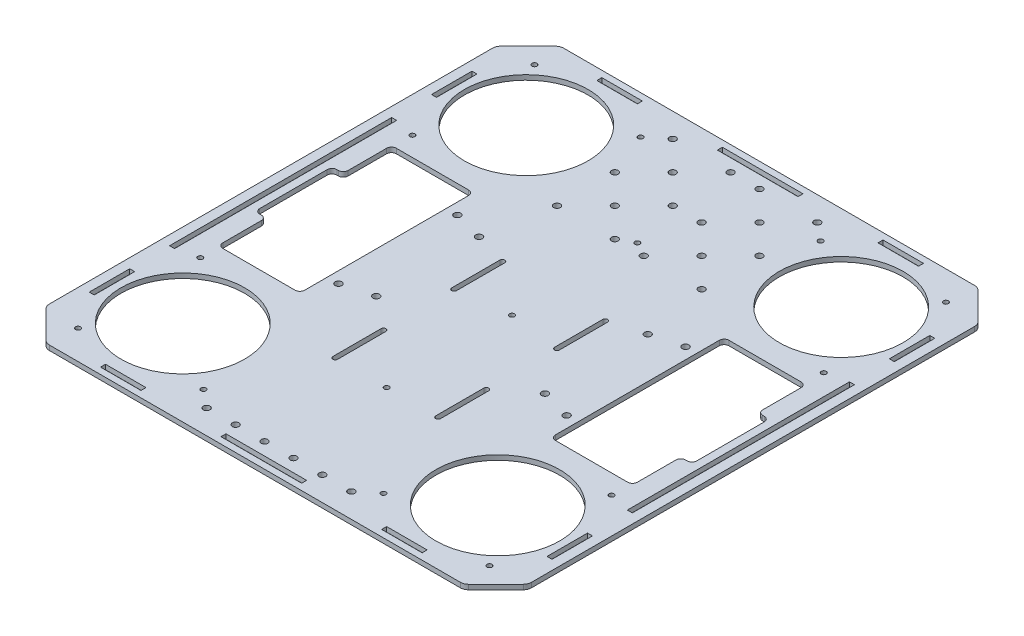
from build123d import *

# Parameters (mm, degrees)
SKETCH1_R          = 2.075
SKETCH1_R_2        = 38.5
BASE_FLANGE1_DEPTH = 3
SKETCH6_R          = 1.55
SKETCH6_W          = 25.2
SKETCH6_H          = 3.1
SKETCH6_W_2        = 3.1
SKETCH6_H_2        = 25.2
SKETCH6_W_3        = 50.2
CUT_EXTRUDE1_DEPTH = 10
FILLET1_R          = 3
SKETCH7_R          = 2.05
CUT_EXTRUDE2_DEPTH = 10


# Sheet-metal steps are written as plain solids
with BuildPart() as part:
    # Sketch1 → Base-Flange1 (new body)
    with BuildSketch(Plane(origin=(0, 0, 0), x_dir=(1, 0, 0), z_dir=(0, 1, 0))):
        with BuildLine():
            Line((150, 137.928932188), (150, 56.076665041))
            Line((150, 56.076665041), (150, -55.923334959))
            Line((150, -55.923334959), (150, -137.928932188))
            ThreePointArc((150, -137.928932188), (149.619397663, -139.84234935), (148.535533906, -141.464466094))
            Line((148.535533906, -141.464466094), (131.464466094, -158.535533906))
            ThreePointArc((131.464466094, -158.535533906), (129.84234935, -159.619397663), (127.928932188, -160))
            Line((127.928932188, -160), (-127.928932188, -160))
            ThreePointArc((-127.928932188, -160), (-129.84234935, -159.619397663), (-131.464466094, -158.535533906))
            Line((-131.464466094, -158.535533906), (-148.535533906, -141.464466094))
            ThreePointArc((-148.535533906, -141.464466094), (-149.619397663, -139.84234935), (-150, -137.928932188))
            Line((-150, -137.928932188), (-150, -55.923334959))
            Line((-150, -55.923334959), (-150, 56.076665041))
            Line((-150, 56.076665041), (-150, 137.928932188))
            ThreePointArc((-150, 137.928932188), (-149.619397663, 139.84234935), (-148.535533906, 141.464466094))
            Line((-148.535533906, 141.464466094), (-131.464466094, 158.535533906))
            ThreePointArc((-131.464466094, 158.535533906), (-129.84234935, 159.619397663), (-127.928932188, 160))
            Line((-127.928932188, 160), (127.928932188, 160))
            ThreePointArc((127.928932188, 160), (129.84234935, 159.619397663), (131.464466094, 158.535533906))
            Line((131.464466094, 158.535533906), (148.535533906, 141.464466094))
            ThreePointArc((148.535533906, 141.464466094), (149.619397663, 139.84234935), (150, 137.928932188))
        make_face()
        with Locations(Location((52.5, 32, 0), (0, 0, 270))):
            Circle(SKETCH1_R, mode=Mode.SUBTRACT)
        with Locations(Location((52.5, -32, 0), (0, 0, 90))):
            Circle(SKETCH1_R, mode=Mode.SUBTRACT)
        with Locations(Location((-52.5, -32, 0), (0, 0, 270))):
            Circle(SKETCH1_R, mode=Mode.SUBTRACT)
        with Locations(Location((-52.5, 32, 0), (0, 0, 90))):
            Circle(SKETCH1_R, mode=Mode.SUBTRACT)
        with Locations(Location((-98, 106.869078783, 0), (0, 0, 270))):
            Circle(SKETCH1_R_2, mode=Mode.SUBTRACT)
        with Locations(Location((98, 106.869078783, 0), (0, 0, 90))):
            Circle(SKETCH1_R_2, mode=Mode.SUBTRACT)
        with Locations(Location((-98, -106.869078783, 0), (0, 0, 90))):
            Circle(SKETCH1_R_2, mode=Mode.SUBTRACT)
        with Locations(Location((98, -106.869078783, 0), (0, 0, 270))):
            Circle(SKETCH1_R_2, mode=Mode.SUBTRACT)
        with Locations(Location((-71, 37, 0), (0, 0, 270))):
            Circle(SKETCH1_R, mode=Mode.SUBTRACT)
        with Locations(Location((-71, -37, 0), (0, 0, 90))):
            Circle(SKETCH1_R, mode=Mode.SUBTRACT)
        with Locations(Location((71, 37, 0), (0, 0, 90))):
            Circle(SKETCH1_R, mode=Mode.SUBTRACT)
        with Locations(Location((71, -37, 0), (0, 0, 270))):
            Circle(SKETCH1_R, mode=Mode.SUBTRACT)
        Polygon((129, 54), (78, 54), (78, -54), (129, -54), (129, -24), (136, -24), (136, 24), (129, 24), align=None, mode=Mode.SUBTRACT)
        Polygon((-129, 54), (-78, 54), (-78, -54), (-129, -54), (-129, -24), (-136, -24), (-136, 24), (-129, 24), align=None, mode=Mode.SUBTRACT)
    extrude(amount=-BASE_FLANGE1_DEPTH)

    # Sketch6 → Cut-Extrude1 (cut)
    with BuildSketch(Plane(origin=(0, 0, 0), x_dir=(1, 0, 0), z_dir=(0, 1, 0))):
        with Locations(Location((128, 142, 0), (0, 0, 270))):
            Circle(SKETCH6_R)
        with Locations(Location((-56, 136, 0), (0, 0, 90))):
            Circle(SKETCH6_R)
        with Locations(Location((-128, 142, 0), (0, 0, 90))):
            Circle(SKETCH6_R)
        with Locations(Location((128, 66, 0), (0, 0, 270))):
            Circle(SKETCH6_R)
        with Locations(Location((56, 136, 0), (0, 0, 270))):
            Circle(SKETCH6_R)
        with Locations(Location((-128, -142, 0), (0, 0, 270))):
            Circle(SKETCH6_R)
        with Locations(Location((128, -66, 0), (0, 0, 90))):
            Circle(SKETCH6_R)
        with Locations(Location((128, -142, 0), (0, 0, 90))):
            Circle(SKETCH6_R)
        with Locations(Location((0, 78, 0), (0, 0, 270))):
            Circle(SKETCH6_R)
        with Locations(Location((0, -78, 0), (0, 0, 90))):
            Circle(SKETCH6_R)
        with Locations(Location((56, -136, 0), (0, 0, 90))):
            Circle(SKETCH6_R)
        with Locations(Location((-56, -136, 0), (0, 0, 270))):
            Circle(SKETCH6_R)
        with Locations(Location((-128, 66, 0), (0, 0, 90))):
            Circle(SKETCH6_R)
        with Locations(Location((-128, -66, 0), (0, 0, 270))):
            Circle(SKETCH6_R)
        with Locations(Location((0, 0, 0), (0, 0, 270))):
            Circle(SKETCH6_R)
        with Locations((87.5, 154.45)):
            Rectangle(SKETCH6_W, SKETCH6_H)
        Polygon((140.9, 54), (140.9, 69.1), (144, 69.1), (144, 54), (144, -54), (144, -69.1), (140.9, -69.1), (140.9, -54), align=None)
        with Locations((142.45, 106.5)):
            Rectangle(SKETCH6_W_2, SKETCH6_H_2)
        with Locations((0, 154.45)):
            Rectangle(SKETCH6_W_3, SKETCH6_H)
        with Locations((-87.5, 154.45)):
            Rectangle(SKETCH6_W, SKETCH6_H)
        Polygon((-144, 69.1), (-144, 54), (-144, -54), (-144, -69.1), (-140.9, -69.1), (-140.9, -54), (-140.9, 54), (-140.9, 69.1), align=None)
        with Locations((-142.45, 106.5)):
            Rectangle(SKETCH6_W_2, SKETCH6_H_2)
        with Locations((-142.45, -106.5)):
            Rectangle(SKETCH6_W_2, SKETCH6_H_2)
        with Locations((142.45, -106.5)):
            Rectangle(SKETCH6_W_2, SKETCH6_H_2)
        with Locations((87.5, -154.45)):
            Rectangle(SKETCH6_W, SKETCH6_H)
        with Locations((-87.5, -154.45)):
            Rectangle(SKETCH6_W, SKETCH6_H)
        with Locations((0, -154.45)):
            Rectangle(SKETCH6_W_3, SKETCH6_H)
        with BuildLine():
            Line((-33.5, -78), (-33.5, -48))
            ThreePointArc((-33.5, -48), (-32, -46.5), (-30.5, -48))
            Line((-30.5, -48), (-30.5, -78))
            ThreePointArc((-30.5, -78), (-32, -79.5), (-33.5, -78))
        make_face()
        with BuildLine():
            Line((33.5, -78), (33.5, -48))
            ThreePointArc((33.5, -48), (32, -46.5), (30.5, -48))
            Line((30.5, -48), (30.5, -78))
            ThreePointArc((30.5, -78), (32, -79.5), (33.5, -78))
        make_face()
        with BuildLine():
            Line((-33.5, -4), (-33.5, 26))
            ThreePointArc((-33.5, 26), (-32, 27.5), (-30.5, 26))
            Line((-30.5, 26), (-30.5, -4))
            ThreePointArc((-30.5, -4), (-32, -5.5), (-33.5, -4))
        make_face()
        with BuildLine():
            Line((33.5, -4), (33.5, 26))
            ThreePointArc((33.5, 26), (32, 27.5), (30.5, 26))
            Line((30.5, 26), (30.5, -4))
            ThreePointArc((30.5, -4), (32, -5.5), (33.5, -4))
        make_face()
    extrude(amount=-CUT_EXTRUDE1_DEPTH, mode=Mode.SUBTRACT)

    # Fillet1
    fillet1_edges = [part.edges().sort_by_distance(p)[0] for p in [
        (-78, -1.5, -54),
        (-78, -1.5, 54),
        (-129, -1.5, 54),
        (-129, -1.5, 24),
        (-136, -1.5, 24),
        (-136, -1.5, -24),
        (-129, -1.5, -24),
        (-129, -1.5, -54),
        (129, -1.5, 54),
        (78, -1.5, 54),
        (78, -1.5, -54),
        (129, -1.5, -54),
        (129, -1.5, -24),
        (136, -1.5, -24),
        (136, -1.5, 24),
        (129, -1.5, 24),
    ]]
    fillet(fillet1_edges, radius=FILLET1_R)

    # Sketch7 → Cut-Extrude2 (cut)
    with BuildSketch(Plane(origin=(0, 0, 0), x_dir=(1, 0, 0), z_dir=(0, 1, 0))):
        with Locations(Location((-27, -145, 0), (0, 0, 270))):
            Circle(SKETCH7_R)
        with Locations(Location((-9, -145, 0), (0, 0, 270))):
            Circle(SKETCH7_R)
        with Locations(Location((-45, -145, 0), (0, 0, 270))):
            Circle(SKETCH7_R)
        with Locations(Location((45, -145, 0), (0, 0, 90))):
            Circle(SKETCH7_R)
        with Locations(Location((27, -145, 0), (0, 0, 90))):
            Circle(SKETCH7_R)
        with Locations(Location((9, -145, 0), (0, 0, 90))):
            Circle(SKETCH7_R)
        with Locations(Location((9, 145, 0), (0, 0, 270))):
            Circle(SKETCH7_R)
        with Locations(Location((45, 145, 0), (0, 0, 270))):
            Circle(SKETCH7_R)
        with Locations(Location((-45, 145, 0), (0, 0, 90))):
            Circle(SKETCH7_R)
        with Locations(Location((-9, 145, 0), (0, 0, 90))):
            Circle(SKETCH7_R)
        with Locations(Location((27, 127, 0), (0, 0, 270))):
            Circle(SKETCH7_R)
        with Locations(Location((9, 109, 0), (0, 0, 270))):
            Circle(SKETCH7_R)
        with Locations(Location((45, 109, 0), (0, 0, 270))):
            Circle(SKETCH7_R)
        with Locations(Location((27, 91, 0), (0, 0, 270))):
            Circle(SKETCH7_R)
        with Locations(Location((-27, 91, 0), (0, 0, 90))):
            Circle(SKETCH7_R)
        with Locations(Location((-45, 109, 0), (0, 0, 90))):
            Circle(SKETCH7_R)
        with Locations(Location((-9, 109, 0), (0, 0, 90))):
            Circle(SKETCH7_R)
        with Locations(Location((-27, 127, 0), (0, 0, 90))):
            Circle(SKETCH7_R)
        with Locations(Location((45, 73, 0), (0, 0, 270))):
            Circle(SKETCH7_R)
        with Locations(Location((9, 73, 0), (0, 0, 270))):
            Circle(SKETCH7_R)
        with Locations(Location((-9, 73, 0), (0, 0, 90))):
            Circle(SKETCH7_R)
        with Locations(Location((-45, 73, 0), (0, 0, 90))):
            Circle(SKETCH7_R)
    extrude(amount=-CUT_EXTRUDE2_DEPTH, mode=Mode.SUBTRACT)


solid = part.part
